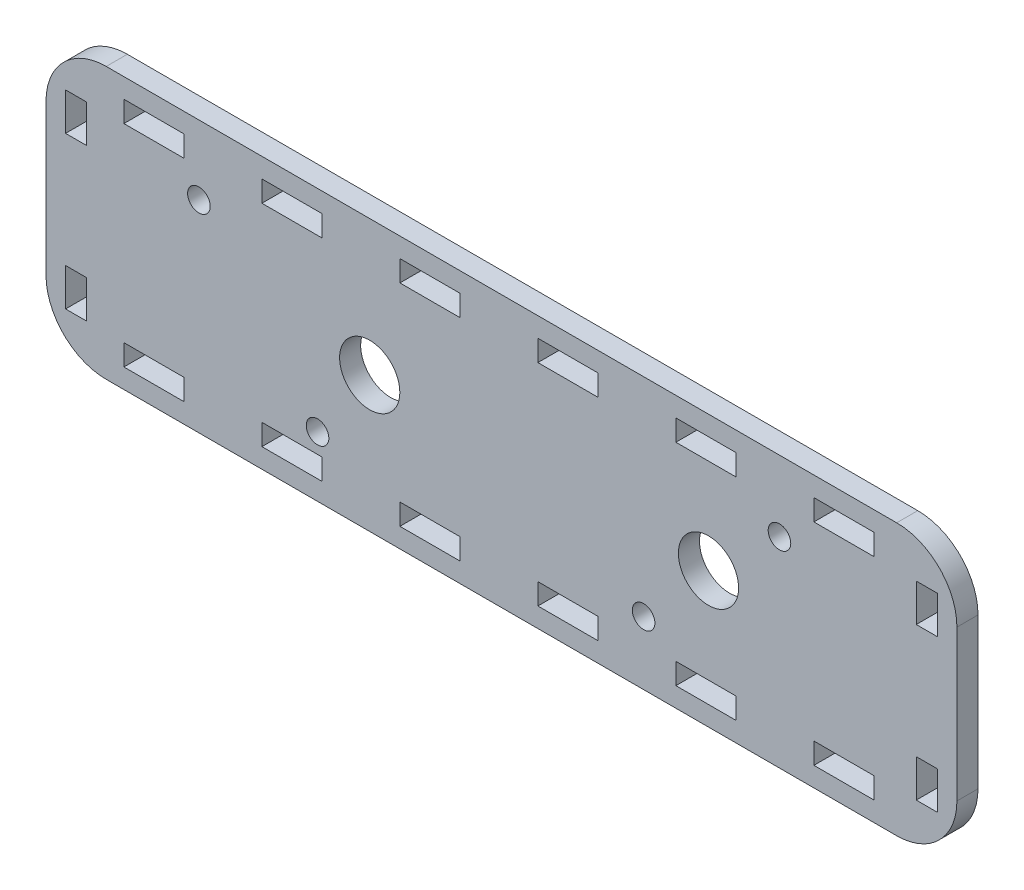
from build123d import *

# Parameters (mm, degrees)
SKETCH_1_W               = 121
SKETCH_1_H               = 36
SKETCH_1_W_2             = 8
SKETCH_1_H_2             = 2.8
SKETCH_1_W_3             = 2.8
SKETCH_1_H_3             = 5
SKETCH_1_R               = 4
EXTRUDE_1_DEPTH          = 1.4
CUT_EXTRUDE_1_DEPTH      = 64.182988217
CUT_EXTRUDE_1_DEPTH_BACK = 64.182988217
SKETCH_2_R               = 1.5
FILLET_1_R               = 8


with BuildPart() as part:
    # Эскиз1 → Бобышка-Вытянуть1 (new, symmetric)
    with BuildSketch(Plane.XY):
        Rectangle(SKETCH_1_W, SKETCH_1_H)
        with Locations((-46.15, -14)):
            Rectangle(SKETCH_1_W_2, SKETCH_1_H_2, mode=Mode.SUBTRACT)
        with Locations((-56.5, -10.1)):
            Rectangle(SKETCH_1_W_3, SKETCH_1_H_3, mode=Mode.SUBTRACT)
        with Locations((-27.82, -14)):
            Rectangle(SKETCH_1_W_2, SKETCH_1_H_2, mode=Mode.SUBTRACT)
        with Locations((-9.49, -14)):
            Rectangle(SKETCH_1_W_2, SKETCH_1_H_2, mode=Mode.SUBTRACT)
        with Locations((8.84, -14)):
            Rectangle(SKETCH_1_W_2, SKETCH_1_H_2, mode=Mode.SUBTRACT)
        with Locations((27.17, -14)):
            Rectangle(SKETCH_1_W_2, SKETCH_1_H_2, mode=Mode.SUBTRACT)
        with Locations((45.5, -14)):
            Rectangle(SKETCH_1_W_2, SKETCH_1_H_2, mode=Mode.SUBTRACT)
        with Locations((56.5, -10.1)):
            Rectangle(SKETCH_1_W_3, SKETCH_1_H_3, mode=Mode.SUBTRACT)
        with Locations((-17.5, 0)):
            Circle(SKETCH_1_R, mode=Mode.SUBTRACT)
        with Locations((-56.5, 10.1)):
            Rectangle(SKETCH_1_W_3, SKETCH_1_H_3, mode=Mode.SUBTRACT)
        with Locations((-46.15, 14)):
            Rectangle(SKETCH_1_W_2, SKETCH_1_H_2, mode=Mode.SUBTRACT)
        with Locations((-27.82, 14)):
            Rectangle(SKETCH_1_W_2, SKETCH_1_H_2, mode=Mode.SUBTRACT)
        with Locations((-9.49, 14)):
            Rectangle(SKETCH_1_W_2, SKETCH_1_H_2, mode=Mode.SUBTRACT)
        with Locations((27.5, 0)):
            Circle(SKETCH_1_R, mode=Mode.SUBTRACT)
        with Locations((8.84, 14)):
            Rectangle(SKETCH_1_W_2, SKETCH_1_H_2, mode=Mode.SUBTRACT)
        with Locations((27.17, 14)):
            Rectangle(SKETCH_1_W_2, SKETCH_1_H_2, mode=Mode.SUBTRACT)
        with Locations((56.5, 10.1)):
            Rectangle(SKETCH_1_W_3, SKETCH_1_H_3, mode=Mode.SUBTRACT)
        with Locations((45.5, 14)):
            Rectangle(SKETCH_1_W_2, SKETCH_1_H_2, mode=Mode.SUBTRACT)
    extrude(amount=EXTRUDE_1_DEPTH, both=True)

    # Эскиз2 → Вырез-Вытянуть1 (cut, two sides: drawn at the far end of the back side and taken through both)
    with BuildSketch(Plane.XY.offset(1.4).offset(-CUT_EXTRUDE_1_DEPTH_BACK)):
        with Locations((-40.188556778, 8.8)):
            Circle(SKETCH_2_R)
        with Locations((-24.431065889, -10)):
            Circle(SKETCH_2_R)
        with Locations((18.880653754, -9.6)):
            Circle(SKETCH_2_R)
        with Locations((36.928786921, 8.6)):
            Circle(SKETCH_2_R)
    extrude(amount=CUT_EXTRUDE_1_DEPTH + CUT_EXTRUDE_1_DEPTH_BACK, mode=Mode.SUBTRACT)

    # Скругление1
    fillet_1_edges = [part.edges().sort_by_distance(p)[0] for p in [
        (60.5, -18, 0),
        (60.5, 18, 0),
        (-60.5, -18, 0),
        (-60.5, 18, 0),
    ]]
    fillet(fillet_1_edges, radius=FILLET_1_R)


solid = part.part
